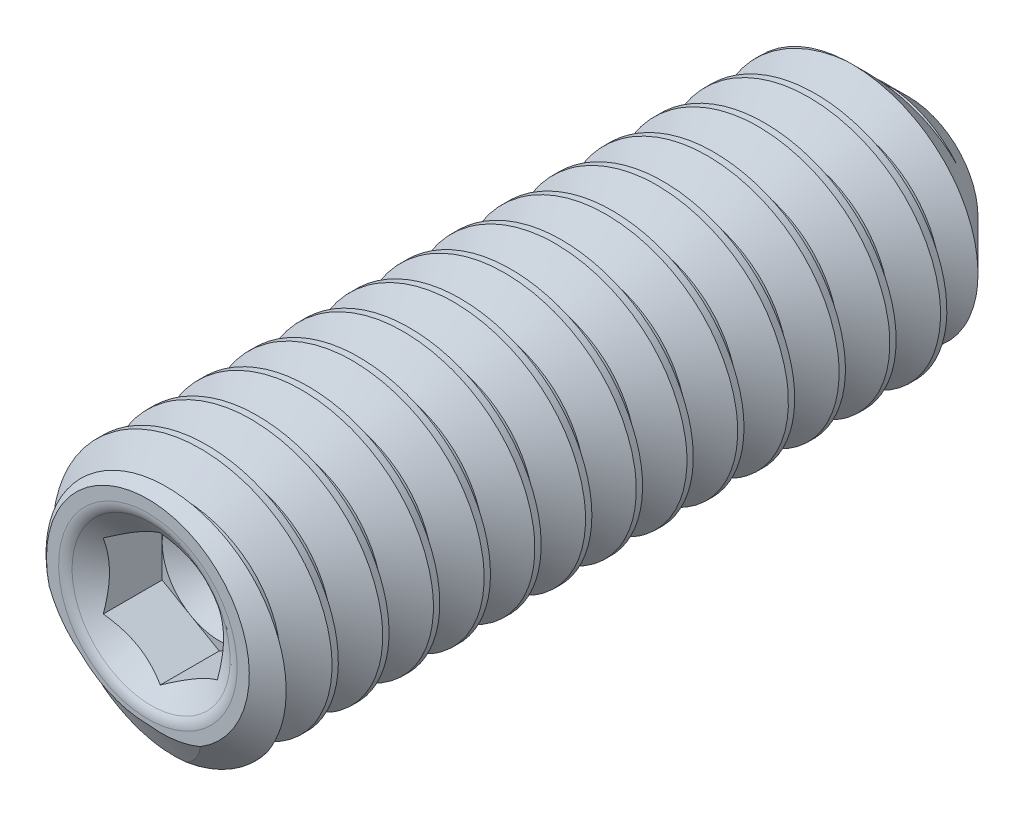
from build123d import *

# Parameters (mm, degrees)
CUT_SWEEP2_PITCH    = 0.4
CUT_EXTRUDE10_DEPTH = 0.5625
FILLET2_R           = 0.140192379


with BuildPart() as part:
    # Sketch22 → Revolve1 (revolve)
    with BuildSketch(Plane(origin=(0, 0, 0), x_dir=(0, 0, -1), z_dir=(1, 0, 0)), mode=Mode.PRIVATE) as revolve1_sk:
        Polygon((-2.835374734, 0), (-2.835374734, 0.8), (-2.695333226, 1), (2.712590173, 1), (3.164625266, 0.547964906), (2.835374734, 0), align=None)
    revolve(revolve1_sk.sketch.rotate(Axis((0, 0, -2.835374734), (0, 0, -1)), 180), axis=Axis((0, 0, -2.835374734), (0, 0, -1)))

    # Cut-Sweep2: the profile of Sketch28 profile screwed along a right-hand helix of 16 turns, 6 arcs to a turn; built about Z, then put on its axis
    cut_sweep2_z = Axis((0, 0, 0), (0, 0, 1))
    cut_sweep2_corners = [(1.0003, 0, 0.000173205), (1.0003, 0, -0.350173205), (0.740192379, 0, -0.2), (0.740192379, 0, -0.15)]
    with BuildLine(mode=Mode.PRIVATE) as cut_sweep2_profile:
        Line(cut_sweep2_corners[0], cut_sweep2_corners[1])
        Line(cut_sweep2_corners[1], cut_sweep2_corners[2])
        Line(cut_sweep2_corners[2], cut_sweep2_corners[3])
        Line(cut_sweep2_corners[3], cut_sweep2_corners[0])
    cut_sweep2_cap = Face(cut_sweep2_profile.wire())
    cut_sweep2_turn_angles = [0, 30, 60, 90, 120, 150, 180, 210, 240, 270, 300, 330, 360]
    cut_sweep2_turn_weights = [1, 0.8660254037844387, 1, 0.8660254037844387, 1, 0.8660254037844387, 1, 0.8660254037844387, 1, 0.8660254037844387, 1, 0.8660254037844387, 1]
    cut_sweep2_turn_rails = [Edge.make_bspline([Vector(p[0], p[1], 0).rotate(cut_sweep2_z, cut_sweep2_turn_angles[k]) / cut_sweep2_turn_weights[k] + Vector(0, 0, p[2] + CUT_SWEEP2_PITCH * cut_sweep2_turn_angles[k] / 360) for k in range(13)], [0, 0, 0, 1, 1, 2, 2, 3, 3, 4, 4, 5, 5, 6, 6, 6], 2, cut_sweep2_turn_weights) for p in cut_sweep2_corners]
    cut_sweep2_turn_sides = [Face.make_surface_from_curves(cut_sweep2_turn_rails[p[0]], cut_sweep2_turn_rails[p[1]]) for p in [(0, 1), (1, 2), (2, 3), (3, 0)]]
    cut_sweep2 = Plane(origin=(0, 0, -3.164625266), x_dir=(0, 1, 0), z_dir=(0, 0, 1)) * Solid(Shell([*[p.moved(Location((0, 0, CUT_SWEEP2_PITCH * i))) for i in range(16) for p in cut_sweep2_turn_sides], cut_sweep2_cap, cut_sweep2_cap.rotate(cut_sweep2_z, 5760).moved(Location((0, 0, CUT_SWEEP2_PITCH * 5760 / 360)))]))
    add(cut_sweep2, mode=Mode.SUBTRACT)

    # Sketch23 → Cut-Extrude10 (cut)
    with BuildSketch(Plane.XY.offset(2.835374734)):
        Polygon((0, 0.519615242), (-0.45, 0.259807621), (-0.45, -0.259807621), (0, -0.519615242), (0.45, -0.259807621), (0.45, 0.259807621), align=None)
    extrude(amount=-CUT_EXTRUDE10_DEPTH, mode=Mode.SUBTRACT)

    # Cut-Extrude11 cone 1 section (through the dimple's axis) → Cut-Extrude11 (revolve, cut)
    with BuildSketch(Plane(origin=(0, 0, 2.835374734), x_dir=(0, -1, 0), z_dir=(1, 0, 0))):
        Polygon((0, 0), (0.659807621, 0), (0, 0.46200227), align=None)
    revolve(axis=Axis((0, 0, 2.835374734), (0, 0, -1)), mode=Mode.SUBTRACT)

    # Cut-Extrude12 cone 1 section (through the dimple's axis) → Cut-Extrude12 (revolve, cut)
    with BuildSketch(Plane(origin=(0, 0, 2.272874734), x_dir=(0, -1, 0), z_dir=(1, 0, 0))):
        Polygon((0, 0), (0.45, 0), (0, 0.259807621), align=None)
    revolve(axis=Axis((0, 0, 2.272874734), (0, 0, -1)), mode=Mode.SUBTRACT)

    # Fillet2
    fillet2_edges = [part.edges().sort_by_distance(p)[0] for p in [
        (0, 0.659807621, 2.835374734),
    ]]
    fillet(fillet2_edges, radius=FILLET2_R)


solid = part.part
